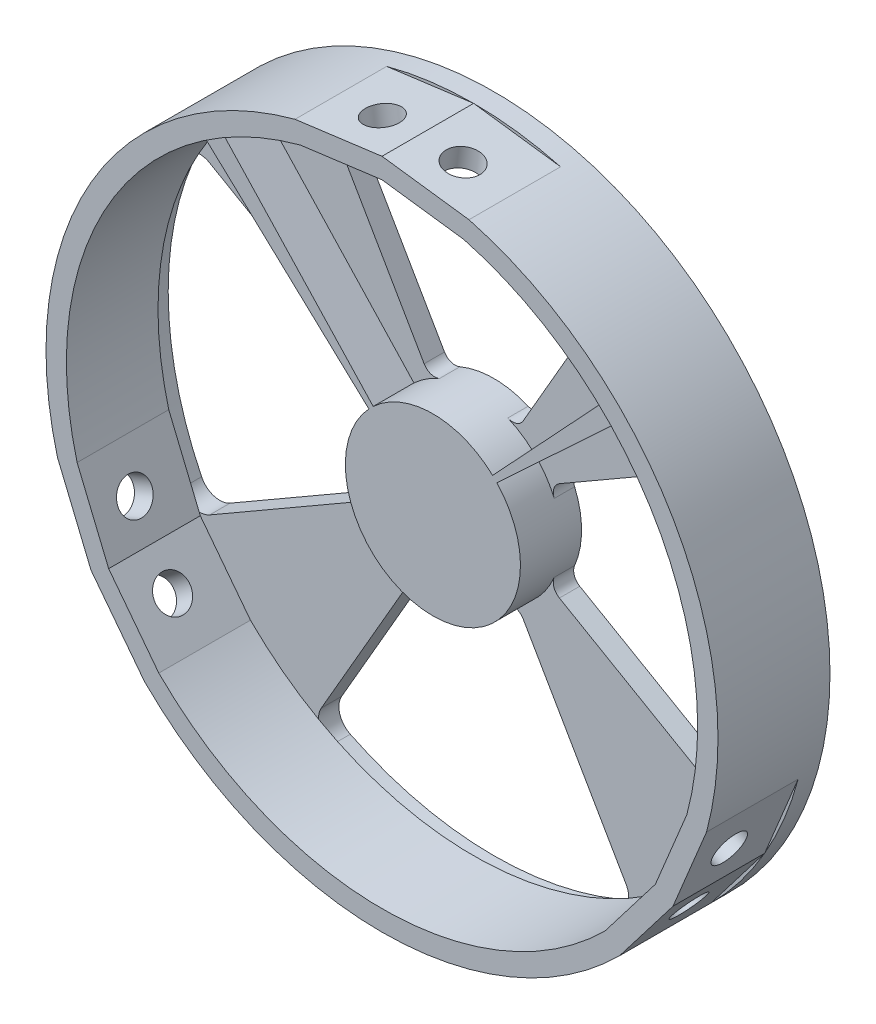
from build123d import *

# Parameters (mm, degrees)
EXTRUDE_1_DEPTH                  = 20
EXTRUDE_1_DEPTH_BACK             = 7.5
EXTRUDE_3_DEPTH                  = 7.5
EXTRUDE_3_DEPTH_BACK             = 7.5
SKETCH_3_R                       = 21.5
SKETCH_4_R                       = 18.5
CUT_EXTRUDE_1_DEPTH              = 7.5
SKETCH_12_W                      = 5
SKETCH_12_H                      = 61
CUT_EXTRUDE_6_DEPTH              = 119.822346383
REVOLVE_START                    = -2.5
REVOLVE_3_DEPTH                  = 10
FILLET_1_R                       = 2
PATTERN_CIRCULAR_1_COUNT         = 2
PATTERN_CIRCULAR_1_ANGLE         = 90
FILLET_1_OF_PATTERN_CIRCULAR_1_R = 2
CUT_EXTRUDE_7_REACH              = 191.328
SKETCH_15_R                      = 4.2
CUT_EXTRUDE_8_REACH              = 191.328
SKETCH_16_R                      = 4.2
PATTERN_CIRCULAR_2_COUNT         = 3


# Read off the part's stored shape, not the designer's step: 旋转3
with BuildPart() as part:
    # 草图1 → 凸台-拉伸1 (new, two sides: drawn at the far end of the back side and taken through both)
    with BuildSketch(Plane.XY.offset(-EXTRUDE_1_DEPTH_BACK)):
        with BuildLine():
            Line((0, 82.5), (21.352571221, 79.688880669))
            ThreePointArc((21.352571221, 79.688880669), (71.447095812, 41.25), (79.688880669, -21.352571221))
            Line((79.688880669, -21.352571221), (71.447095812, -41.25))
            Line((71.447095812, -41.25), (58.336309448, -58.336309448))
            ThreePointArc((58.336309448, -58.336309448), (0, -82.5), (-58.336309448, -58.336309448))
            Line((-58.336309448, -58.336309448), (-71.447095812, -41.25))
            Line((-71.447095812, -41.25), (-79.688880669, -21.352571221))
            ThreePointArc((-79.688880669, -21.352571221), (-71.447095812, 41.25), (-21.352571221, 79.688880669))
            Line((-21.352571221, 79.688880669), (0, 82.5))
        make_face()
        with BuildLine():
            Line((0, 77.5), (20.058475995, 74.859251537))
            ThreePointArc((20.058475995, 74.859251537), (67.116968793, 38.75), (74.859251537, -20.058475995))
            Line((74.859251537, -20.058475995), (67.116968793, -38.75))
            Line((67.116968793, -38.75), (54.800775542, -54.800775542))
            ThreePointArc((54.800775542, -54.800775542), (0, -77.5), (-54.800775542, -54.800775542))
            Line((-54.800775542, -54.800775542), (-67.116968793, -38.75))
            Line((-67.116968793, -38.75), (-74.859251537, -20.058475995))
            ThreePointArc((-74.859251537, -20.058475995), (-67.116968793, 38.75), (-20.058475995, 74.859251537))
            Line((-20.058475995, 74.859251537), (0, 77.5))
        make_face(mode=Mode.SUBTRACT)
    extrude(amount=EXTRUDE_1_DEPTH + EXTRUDE_1_DEPTH_BACK)



with BuildPart() as body_2:
    # 草图3 → 凸台-拉伸3 (new, two sides: drawn at the far end of the back side and taken through both)
    with BuildSketch(Plane.XY.offset(-EXTRUDE_3_DEPTH_BACK)):
        Circle(SKETCH_3_R)
    extrude(amount=EXTRUDE_3_DEPTH + EXTRUDE_3_DEPTH_BACK)

    # 草图4 → 切除-拉伸1 (cut)
    with BuildSketch(Plane(origin=(0, 0, -7.5), x_dir=(-1, 0, 0), z_dir=(0, 0, -1))):
        Circle(SKETCH_4_R)
    extrude(amount=-CUT_EXTRUDE_1_DEPTH, mode=Mode.SUBTRACT)


with BuildPart() as part_1:
    add(part.part)

    add(body_2.part)  # 旋转2 merges body 2
    # 草图12 → 旋转2 (revolve)
    with BuildSketch(Plane(origin=(0, 0, 0), x_dir=(0, 0, -1), z_dir=(1, 0, 0)), mode=Mode.PRIVATE) as revolve_2_sk:
        with Locations((5, 52)):
            Rectangle(SKETCH_12_W, SKETCH_12_H)
    revolve(revolve_2_sk.sketch.rotate(Axis((0, 0, 0), (0, 0, -1)), 90), axis=Axis((0, 0, 0), (0, 0, -1)))

    # 草图13 → 切除-拉伸6 (cut, through all)
    with BuildSketch(Plane.XY.offset(-2.5)):
        with BuildLine():
            Line((-36.163690354, 62.637349082), (-12.157816416, 21.057955741))
            ThreePointArc((-12.157816416, 21.057955741), (-10.512484879, 19.713262861), (-8.389159771, 19.795757079))
            ThreePointArc((-8.389159771, 19.795757079), (0, 21.5), (8.389159771, 19.795757079))
            ThreePointArc((8.389159771, 19.795757079), (10.512484879, 19.713262861), (12.157816416, 21.057955741))
            Line((12.157816416, 21.057955741), (36.163690354, 62.637349082))
            ThreePointArc((36.163690354, 62.637349082), (36.615666268, 66.597311937), (34.028981496, 69.629580053))
            ThreePointArc((34.028981496, 69.629580053), (0, 77.5), (-34.028981496, 69.629580053))
            ThreePointArc((-34.028981496, 69.629580053), (-36.615666268, 66.597311937), (-36.163690354, 62.637349082))
        make_face()
        with BuildLine():
            Line((64.807406984, 37.416573868), (21.057955741, 12.157816416))
            ThreePointArc((21.057955741, 12.157816416), (19.713262861, 10.512484879), (19.795757079, 8.389159771))
            ThreePointArc((19.795757079, 8.389159771), (21.5, 0), (19.795757079, -8.389159771))
            ThreePointArc((19.795757079, -8.389159771), (19.713262861, -10.512484879), (21.057955741, -12.157816416))
            Line((21.057955741, -12.157816416), (64.807406984, -37.416573868))
            ThreePointArc((64.807406984, -37.416573868), (68.761859517, -37.870228599), (71.79456745, -35.292209972))
            ThreePointArc((71.79456745, -35.292209972), (80, 0), (71.79456745, 35.292209972))
            ThreePointArc((71.79456745, 35.292209972), (68.761859517, 37.870228599), (64.807406984, 37.416573868))
        make_face()
        with BuildLine():
            Line((37.416573868, -64.807406984), (12.157816416, -21.057955741))
            ThreePointArc((12.157816416, -21.057955741), (10.512484879, -19.713262861), (8.389159771, -19.795757079))
            ThreePointArc((8.389159771, -19.795757079), (0, -21.5), (-8.389159771, -19.795757079))
            ThreePointArc((-8.389159771, -19.795757079), (-10.512484879, -19.713262861), (-12.157816416, -21.057955741))
            Line((-12.157816416, -21.057955741), (-37.416573868, -64.807406984))
            ThreePointArc((-37.416573868, -64.807406984), (-37.870228599, -68.761859517), (-35.292209972, -71.79456745))
            ThreePointArc((-35.292209972, -71.79456745), (0, -80), (35.292209972, -71.79456745))
            ThreePointArc((35.292209972, -71.79456745), (37.870228599, -68.761859517), (37.416573868, -64.807406984))
        make_face()
        with BuildLine():
            Line((-64.807406984, -37.416573868), (-21.057955741, -12.157816416))
            ThreePointArc((-21.057955741, -12.157816416), (-19.713262861, -10.512484879), (-19.795757079, -8.389159771))
            ThreePointArc((-19.795757079, -8.389159771), (-21.5, 0), (-19.795757079, 8.389159771))
            ThreePointArc((-19.795757079, 8.389159771), (-19.713262861, 10.512484879), (-21.057955741, 12.157816416))
            Line((-21.057955741, 12.157816416), (-64.807406984, 37.416573868))
            ThreePointArc((-64.807406984, 37.416573868), (-68.761859517, 37.870228599), (-71.79456745, 35.292209972))
            ThreePointArc((-71.79456745, 35.292209972), (-80, 0), (-71.79456745, -35.292209972))
            ThreePointArc((-71.79456745, -35.292209972), (-68.761859517, -37.870228599), (-64.807406984, -37.416573868))
        make_face()
    extrude(amount=-CUT_EXTRUDE_6_DEPTH, mode=Mode.SUBTRACT)

    # 旋转3 outline → 旋转3 (add)
    with BuildSketch(Plane.XY.offset(REVOLVE_START)):
        with BuildLine():
            Line((52.854872905, 56.679911875), (14.662964741, 15.724104585))
            ThreePointArc((14.662964741, 15.724104585), (15.202795796, 15.202795796), (15.724104585, 14.662964741))
            Line((15.724104585, 14.662964741), (56.679911875, 52.854872905))
            ThreePointArc((56.679911875, 52.854872905), (54.800775542, 54.800775542), (52.854872905, 56.679911875))
        make_face()
    revolve_3 = extrude(amount=REVOLVE_3_DEPTH)

    # 圆角1
    fillet_1_edges = [part_1.edges().sort_by_distance(p)[0] for p in [
        (52.854872905, 56.679911875, 2.5),
        (56.679911875, 52.854872905, 2.5),
    ]]
    fillet(fillet_1_edges, radius=FILLET_1_R)

    # 阵列(圆周)1: 旋转3 ×2 about axis
    pattern_circular_1_axis = Axis((0, 0, 0), (0, 0, 1))
    for i in range(1, PATTERN_CIRCULAR_1_COUNT):
        add(revolve_3.rotate(pattern_circular_1_axis, i * PATTERN_CIRCULAR_1_ANGLE / (PATTERN_CIRCULAR_1_COUNT - 1)))

    # 圆角1 of 阵列(圆周)1
    fillet_1_of_pattern_circular_1_edges = [part_1.edges().sort_by_distance(p)[0] for p in [
        (-56.679911875, 52.854872905, 2.5),
        (-52.854872905, 56.679911875, 2.5),
    ]]
    fillet(fillet_1_of_pattern_circular_1_edges, radius=FILLET_1_OF_PATTERN_CIRCULAR_1_R)

    # 草图15 → 切除-拉伸7 (cut, up to next)
    with BuildSketch(Plane(origin=(10.67628561, 81.094440334, 0), x_dir=(0.991444861373809, -0.13052619222006237, 0), z_dir=(0.13052619222006237, 0.9914448613738092, 0)), mode=Mode.PRIVATE) as cut_extrude_7_sk1:
        with Locations(Location((-0.768410858, -10, 0), (0, 0, 180))):
            Circle(SKETCH_15_R)
    cut_extrude_7_tool1 = extrude(cut_extrude_7_sk1.sketch, amount=-CUT_EXTRUDE_7_REACH, mode=Mode.PRIVATE) & part_1.part
    cut_extrude_7 = cut_extrude_7_tool1.solids().sort_by_distance((9.914449, 81.194738, 10))[0]
    add(cut_extrude_7, mode=Mode.SUBTRACT)

    # 草图16 → 切除-拉伸8 (cut, up to next)
    with BuildSketch(Plane(origin=(-10.67628561, 81.094440334, 0), x_dir=(0.991444861373809, 0.13052619222006237, 0), z_dir=(-0.13052619222006237, 0.9914448613738092, 0)), mode=Mode.PRIVATE) as cut_extrude_8_sk1:
        with Locations(Location((0.768410858, -10, 0), (0, 0, 180))):
            Circle(SKETCH_16_R)
    cut_extrude_8_tool1 = extrude(cut_extrude_8_sk1.sketch, amount=-CUT_EXTRUDE_8_REACH, mode=Mode.PRIVATE) & part_1.part
    cut_extrude_8 = cut_extrude_8_tool1.solids().sort_by_distance((-9.914449, 81.194738, 10))[0]
    add(cut_extrude_8, mode=Mode.SUBTRACT)

    # 阵列(圆周)2: 切除-拉伸7, 切除-拉伸8 ×3 about axis
    pattern_circular_2_axis = Axis((0, 0, 0), (0, 0, 1))
    add([cut_extrude_7.rotate(pattern_circular_2_axis, i * 360 / PATTERN_CIRCULAR_2_COUNT) for i in range(1, PATTERN_CIRCULAR_2_COUNT)], mode=Mode.SUBTRACT)
    add([cut_extrude_8.rotate(pattern_circular_2_axis, i * 360 / PATTERN_CIRCULAR_2_COUNT) for i in range(1, PATTERN_CIRCULAR_2_COUNT)], mode=Mode.SUBTRACT)


solid = part_1.part
